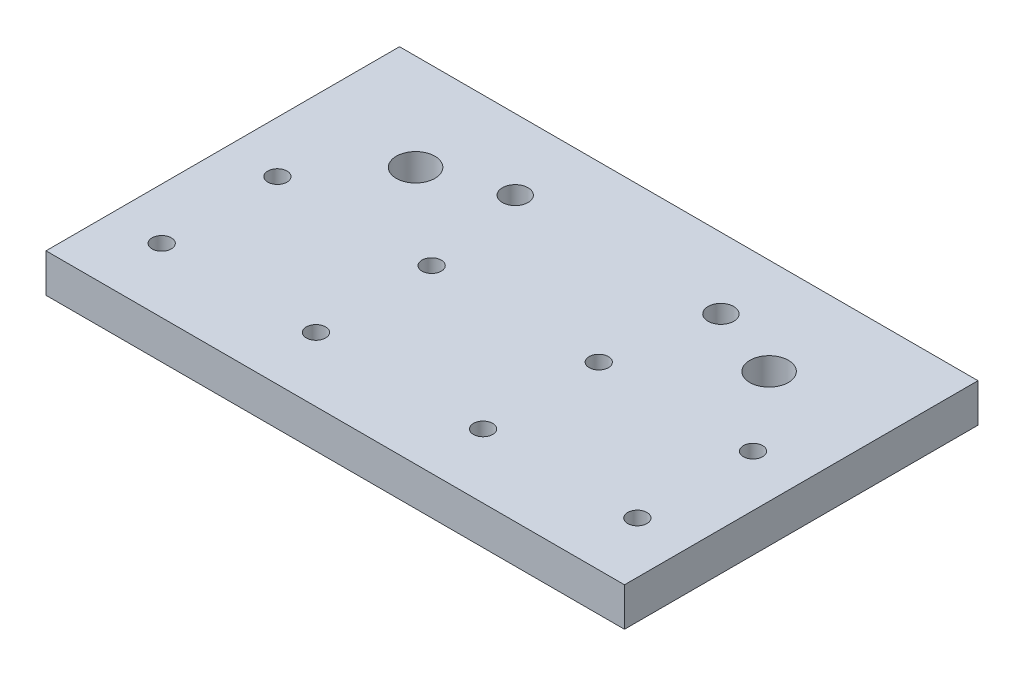
from build123d import *

# Parameters (mm, degrees)
SKETCH1_W           = 90
SKETCH1_H           = 55
SKETCH1_R           = 3
SKETCH1_R_2         = 1.5
BOSS_EXTRUDE1_DEPTH = 6
CUT_EXTRUDE1_REACH  = 56.415
SKETCH2_R           = 2


with BuildPart() as part:
    # Sketch1 → Boss-Extrude1 (new body)
    with BuildSketch(Plane(origin=(0, 0, 0), x_dir=(1, 0, 0), z_dir=(0, 1, 0))):
        with Locations((0, 2.5)):
            Rectangle(SKETCH1_W, SKETCH1_H)
        with Locations((27.5, 15)):
            Circle(SKETCH1_R, mode=Mode.SUBTRACT)
        with Locations((-27.5, 15)):
            Circle(SKETCH1_R, mode=Mode.SUBTRACT)
        with Locations((37, 3)):
            Circle(SKETCH1_R_2, mode=Mode.SUBTRACT)
        with Locations((13, 3)):
            Circle(SKETCH1_R_2, mode=Mode.SUBTRACT)
        with Locations((37, -15)):
            Circle(SKETCH1_R_2, mode=Mode.SUBTRACT)
        with Locations((13, -15)):
            Circle(SKETCH1_R_2, mode=Mode.SUBTRACT)
        with Locations((-37, -15)):
            Circle(SKETCH1_R_2, mode=Mode.SUBTRACT)
        with Locations((-37, 3)):
            Circle(SKETCH1_R_2, mode=Mode.SUBTRACT)
        with Locations((-13, -15)):
            Circle(SKETCH1_R_2, mode=Mode.SUBTRACT)
        with Locations((-13, 3)):
            Circle(SKETCH1_R_2, mode=Mode.SUBTRACT)
    extrude(amount=BOSS_EXTRUDE1_DEPTH)

    # Sketch2 → Cut-Extrude1 (cut, up to next)
    with BuildSketch(Plane(origin=(0, 6, 0), x_dir=(1, 0, 0), z_dir=(0, 1, 0)), mode=Mode.PRIVATE) as cut_extrude1_sk1:
        with Locations((16, 19)):
            Circle(SKETCH2_R)
    cut_extrude1_tool1 = extrude(cut_extrude1_sk1.sketch, amount=-CUT_EXTRUDE1_REACH, mode=Mode.PRIVATE) & part.part
    # Sketch2 → Cut-Extrude1 (cut, up to next)
    with BuildSketch(Plane(origin=(0, 6, 0), x_dir=(1, 0, 0), z_dir=(0, 1, 0)), mode=Mode.PRIVATE) as cut_extrude1_sk2:
        with Locations((-16, 19)):
            Circle(SKETCH2_R)
    cut_extrude1_tool2 = extrude(cut_extrude1_sk2.sketch, amount=-CUT_EXTRUDE1_REACH, mode=Mode.PRIVATE) & part.part
    add(cut_extrude1_tool1.solids().sort_by_distance((16, 6, -19))[0], mode=Mode.SUBTRACT)
    add(cut_extrude1_tool2.solids().sort_by_distance((-16, 6, -19))[0], mode=Mode.SUBTRACT)


solid = part.part
